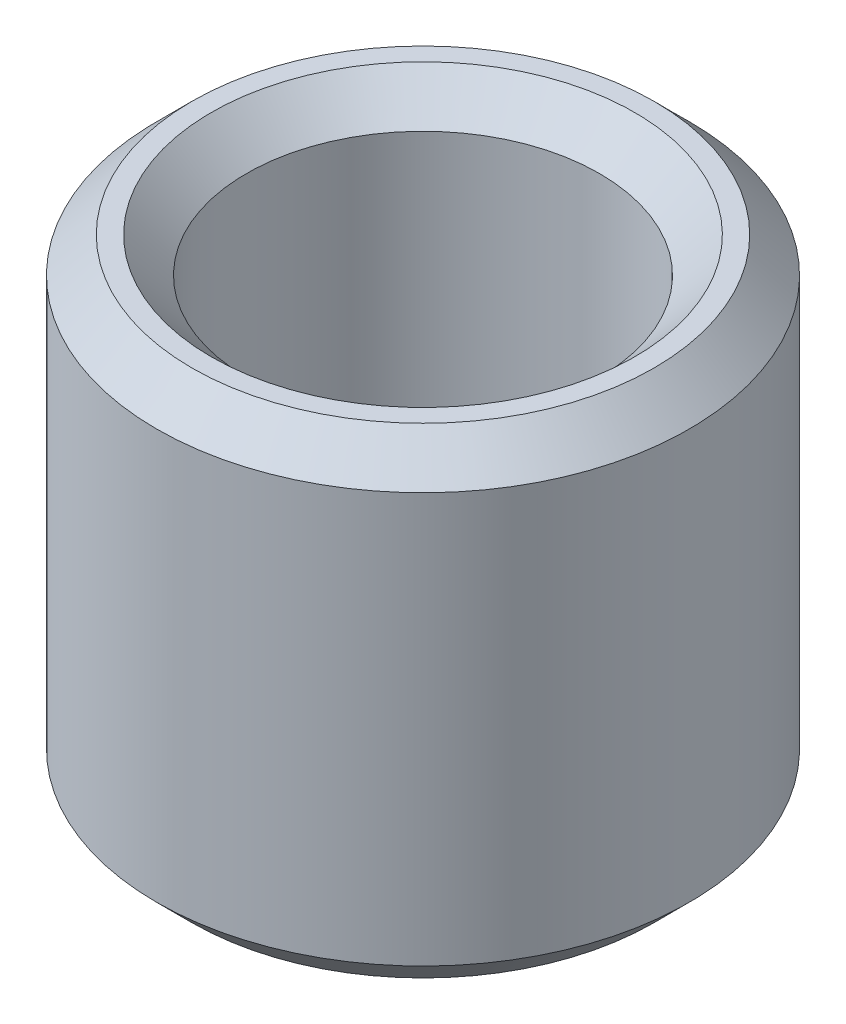
from build123d import *

# Parameters (mm, degrees)
SKETCH1_R           = 15
BOSS_EXTRUDE1_DEPTH = 27.06094191
SKETCH2_R           = 9.940185667
CUT_EXTRUDE1_DEPTH  = 35.384510714
CHAMFER1_SIZE       = 1.985271754


with BuildPart() as part:
    # Sketch1 → Boss-Extrude1 (new body)
    with BuildSketch(Plane(origin=(0, 0, 0), x_dir=(1, 0, 0), z_dir=(0, 1, 0))):
        Circle(SKETCH1_R)
    extrude(amount=BOSS_EXTRUDE1_DEPTH)

    # Sketch2 → Cut-Extrude1 (cut, through all)
    with BuildSketch(Plane(origin=(0, 0, 0), x_dir=(1, 0, 0), z_dir=(0, 1, 0))):
        Circle(SKETCH2_R)
    extrude(amount=CUT_EXTRUDE1_DEPTH, mode=Mode.SUBTRACT)

    # Chamfer1
    chamfer1_edges = [part.edges().sort_by_distance(p)[0] for p in [
        (-9.940185667, 27.06094191, 0),
        (-9.940185667, 0, 0),
        (-15, 0, 0),
        (-15, 27.06094191, 0),
    ]]
    chamfer(chamfer1_edges, length=CHAMFER1_SIZE)


solid = part.part
